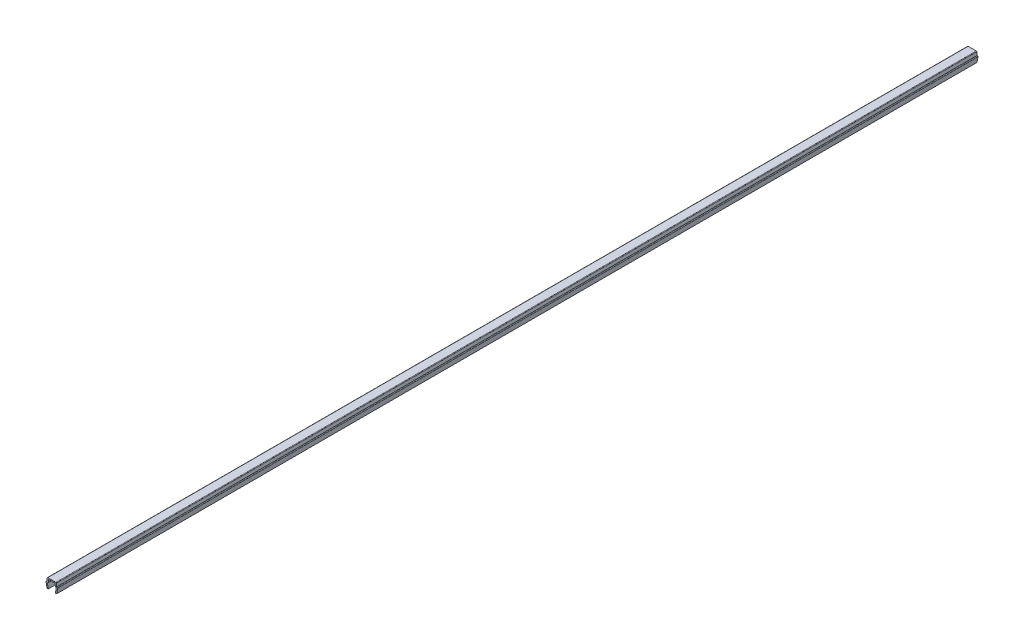
from build123d import *

# Parameters (mm, degrees)
BOSS_EXTRUDE1_DEPTH = 284.75


with BuildPart() as part:
    # Sketch1 → Boss-Extrude1 (new, symmetric)
    with BuildSketch(Plane.XY):
        with BuildLine():
            Line((-3.6, 3.35), (-3, 0))
            Line((-3, 0), (-2.2, 0))
            Line((-2.2, 0), (-2.735217071, 2.988295315))
            ThreePointArc((-2.735217071, 2.988295315), (-2.659117427, 3.274614514), (-2.390699246, 3.4))
            Line((-2.390699246, 3.4), (-2.2, 3.4))
            Line((-2.2, 3.4), (-2.070472639, 4.88050451))
            ThreePointArc((-2.070472639, 4.88050451), (-1.958261067, 5.108047068), (-1.721804495, 5.2))
            Line((-1.721804495, 5.2), (1.721804495, 5.2))
            ThreePointArc((1.721804495, 5.2), (1.958261067, 5.108047068), (2.070472639, 4.88050451))
            Line((2.070472639, 4.88050451), (2.2, 3.4))
            Line((2.2, 3.4), (2.390699246, 3.4))
            ThreePointArc((2.390699246, 3.4), (2.659117427, 3.274614514), (2.735217071, 2.988295315))
            Line((2.735217071, 2.988295315), (2.2, 0))
            Line((2.2, 0), (3, 0))
            Line((3, 0), (3.6, 3.35))
            ThreePointArc((3.6, 3.35), (3.497487373, 3.597487373), (3.25, 3.7))
            Line((3.25, 3.7), (3, 3.7))
            Line((3, 3.7), (2.835477174, 5.58050451))
            ThreePointArc((2.835477174, 5.58050451), (2.723265602, 5.808047068), (2.486809029, 5.9))
            Line((2.486809029, 5.9), (-2.486809029, 5.9))
            ThreePointArc((-2.486809029, 5.9), (-2.723265602, 5.808047068), (-2.835477174, 5.58050451))
            Line((-2.835477174, 5.58050451), (-3, 3.7))
            Line((-3, 3.7), (-3.25, 3.7))
            ThreePointArc((-3.25, 3.7), (-3.497487373, 3.597487373), (-3.6, 3.35))
        make_face()
    extrude(amount=BOSS_EXTRUDE1_DEPTH, both=True)


solid = part.part
